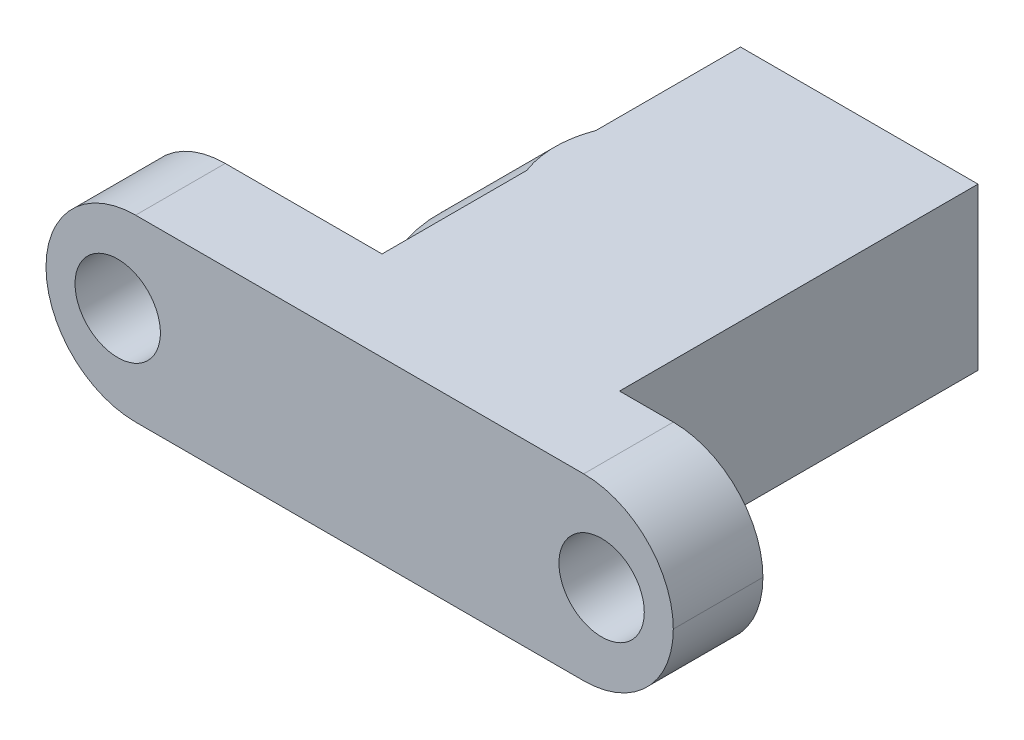
from build123d import *

# Parameters (mm, degrees)
SKETCH1_W           = 35
SKETCH1_H           = 10
SKETCH1_R           = 2.38125
BOSS_EXTRUDE1_DEPTH = 5
BOSS_EXTRUDE2_DEPTH = 20
SKETCH3_R           = 5.5
CUT_EXTRUDE1_DEPTH  = 6
BOSS_EXTRUDE3_START = 10
SKETCH4_R           = 7.5
SKETCH4_R_2         = 5.5
BOSS_EXTRUDE3_DEPTH = 10
FILLET1_R           = 5
BOSS_EXTRUDE4_START = -20
SKETCH5_W           = 1.25
SKETCH5_H           = 0.514718626
BOSS_EXTRUDE4_DEPTH = 20
SKETCH6_W           = 6.624212501
SKETCH6_H           = 0.612418682
CUT_EXTRUDE2_DEPTH  = 33.839440066
BOSS_EXTRUDE5_START = -20
SKETCH7_W           = 1.18849251
SKETCH7_H           = 1
BOSS_EXTRUDE5_DEPTH = 20


with BuildPart() as part:
    # Sketch1 → Boss-Extrude1 (new body)
    with BuildSketch(Plane.XY):
        Rectangle(SKETCH1_W, SKETCH1_H)
        with Locations((13.5, 0)):
            Circle(SKETCH1_R, mode=Mode.SUBTRACT)
        with Locations(Location((-13.5, 0, 0), (0, 0, 180))):
            Circle(SKETCH1_R, mode=Mode.SUBTRACT)
    extrude(amount=BOSS_EXTRUDE1_DEPTH)

    # Sketch2 → Boss-Extrude2 (add)
    with BuildSketch(Plane(origin=(0, 0, 0), x_dir=(-1, 0, 0), z_dir=(0, 0, -1))):
        Polygon((-9.5, -4), (2.5, -4), (2.5, 4), (2.5, 5), (-9.5, 5), (-9.5, 4), align=None)
    extrude(amount=BOSS_EXTRUDE2_DEPTH)

    # Sketch3 → Cut-Extrude1 (cut)
    with BuildSketch(Plane(origin=(-3.25, -3.25, 0), x_dir=(0, 0, 1), z_dir=(-0.7071067811865488, -0.7071067811865464, 0))):
        with Locations(Location((-10, -1.060660172, 0), (0, 0, 270))):
            Circle(SKETCH3_R)
    extrude(amount=-CUT_EXTRUDE1_DEPTH, mode=Mode.SUBTRACT)

    # Sketch4 → Boss-Extrude3 (add)
    with BuildSketch(Plane(origin=(0.992640687, 0.992640687, 0), x_dir=(0, 0, 1), z_dir=(-0.7071067811865488, -0.7071067811865462, 0)).offset(BOSS_EXTRUDE3_START)):
        with Locations(Location((-10, -1.060660172, 0), (0, 0, 53.130102354))):
            Circle(SKETCH4_R)
        with Locations(Location((-10, -1.060660172, 0), (0, 0, 270))):
            Circle(SKETCH4_R_2, mode=Mode.SUBTRACT)
    extrude(amount=-BOSS_EXTRUDE3_DEPTH)

    # Fillet1
    fillet1_edges = [part.edges().sort_by_distance(p)[0] for p in [
        (17.5, 5, 2.5),
        (17.5, -5, 2.5),
        (-17.5, -5, 2.5),
        (-17.5, 5, 2.5),
    ]]
    fillet(fillet1_edges, radius=FILLET1_R - 0.0001)  # a hair under: the kernel refuses the full size

    # Sketch5 → Boss-Extrude4 (add)
    with BuildSketch(Plane(origin=(0, 0, -20), x_dir=(-1, 0, 0), z_dir=(0, 0, -1)).offset(BOSS_EXTRUDE4_START)):
        with Locations((3.125, 4.742640687)):
            Rectangle(SKETCH5_W, SKETCH5_H)
    extrude(amount=BOSS_EXTRUDE4_DEPTH)

    # Sketch6 → Cut-Extrude2 (cut, through all)
    with BuildSketch(Plane(origin=(0, 0, -20), x_dir=(-1, 0, 0), z_dir=(0, 0, -1))):
        with Locations((6.326824877, 5.306209341)):
            Rectangle(SKETCH6_W, SKETCH6_H)
    extrude(amount=-CUT_EXTRUDE2_DEPTH, mode=Mode.SUBTRACT)

    # Sketch7 → Boss-Extrude5 (add)
    with BuildSketch(Plane(origin=(0, 0, -20), x_dir=(-1, 0, 0), z_dir=(0, 0, -1)).offset(BOSS_EXTRUDE5_START)):
        with Locations((-6.579527629, -4.5)):
            Rectangle(SKETCH7_W, SKETCH7_H)
    extrude(amount=BOSS_EXTRUDE5_DEPTH)


solid = part.part
